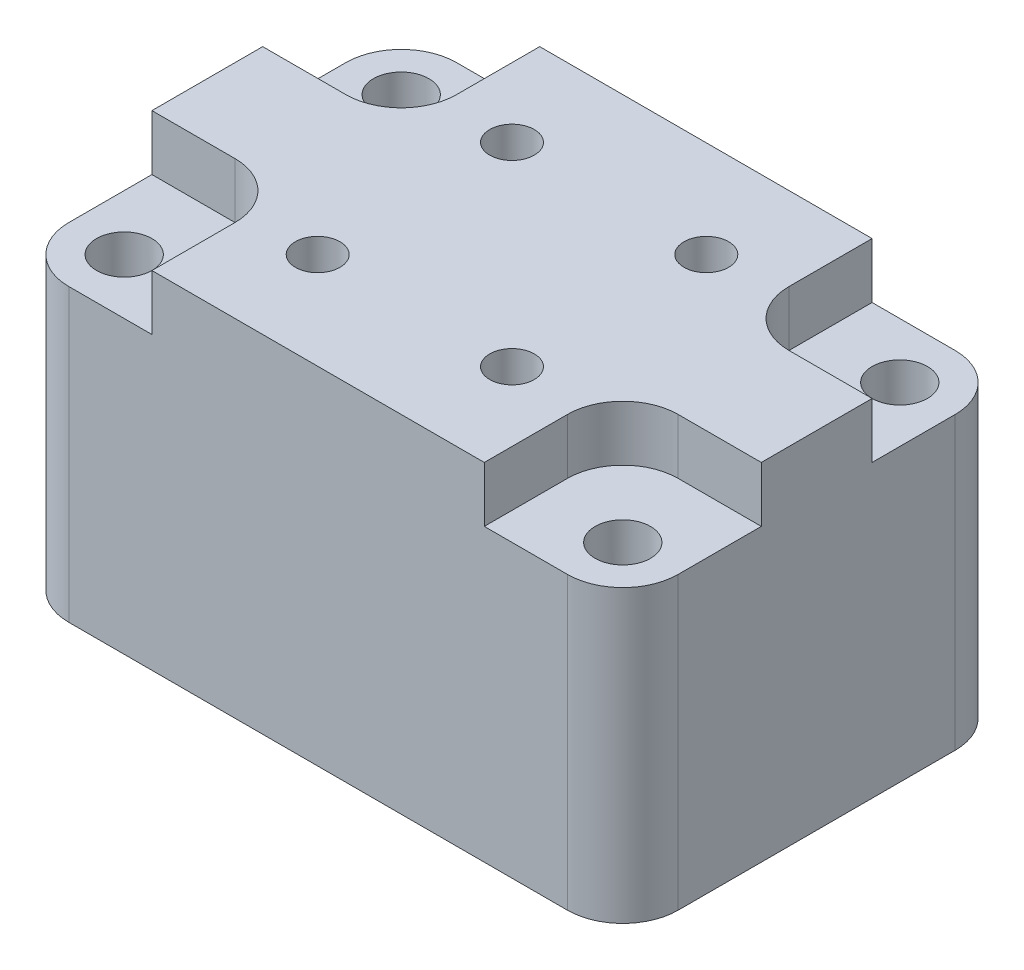
from build123d import *

# Parameters (mm, degrees)
SKETCH1_W                                           = 69.85
SKETCH1_H                                           = 44.45
BOSS_EXTRUDE1_DEPTH                                 = 39.6875
CBORE_FOR_10_BINDING_HEAD_MACHINE_SCREW_D           = 5.1054
CBORE_FOR_10_BINDING_HEAD_MACHINE_SCREW_CBORE_D     = 9.525
CBORE_FOR_10_BINDING_HEAD_MACHINE_SCREW_CBORE_DEPTH = 7.9375
FILLET2_R                                           = 6.35
F_1_4_0_25_DIAMETER_HOLE1_D                         = 6.35
SKETCH9_W                                           = 15.875
SKETCH9_H                                           = 15.875
CUT_EXTRUDE1_DEPTH                                  = 6.35
FILLET3_R                                           = 6.35
FILLET3_OF_MIRROR2_R                                = 6.35
MIRROR3_START                                       = 33.3375
MIRROR3_OUTLINE_R                                   = 3.175
MIRROR3_DEPTH                                       = 6.35


# Read off the part's stored shape, not the designer's step: Mirror3
with BuildPart() as part:
    # Sketch1 → Boss-Extrude1 (new body)
    with BuildSketch(Plane(origin=(0, 0, 0), x_dir=(1, 0, 0), z_dir=(0, 1, 0))):
        Rectangle(SKETCH1_W, SKETCH1_H)
    extrude(amount=BOSS_EXTRUDE1_DEPTH)

    # CBORE for #10 Binding Head Machine Screw1 (through all)
    with Locations(Plane(origin=(0, 0, 0), x_dir=(-1, 0, 0), z_dir=(0, -1, 0))):
        with Locations((-11.136931804, 11.136931804), (11.136931804, 11.136931804), (11.136931804, -11.136931804), (-11.136931804, -11.136931804)):
            CounterBoreHole(CBORE_FOR_10_BINDING_HEAD_MACHINE_SCREW_D / 2, CBORE_FOR_10_BINDING_HEAD_MACHINE_SCREW_CBORE_D / 2, CBORE_FOR_10_BINDING_HEAD_MACHINE_SCREW_CBORE_DEPTH)

    # Fillet2
    fillet2_edges = [part.edges().sort_by_distance(p)[0] for p in [
        (34.925, 19.84375, 22.225),
        (-34.925, 19.84375, 22.225),
        (-34.925, 19.84375, -22.225),
        (34.925, 19.84375, -22.225),
    ]]
    fillet(fillet2_edges, radius=FILLET2_R)

    # 1/4 (0.25) Diameter Hole1 (through all)
    with Locations(Plane(origin=(0, 39.6875, 0), x_dir=(-1, 0, 0), z_dir=(0, 1, 0))):
        with Locations((-28.575, -15.875), (-28.575, 15.875), (28.575, 15.875), (28.575, -15.875)):
            f_1_4_0_25_diameter_hole1 = Hole(F_1_4_0_25_DIAMETER_HOLE1_D / 2)

    # Mirror1: 1/4 (0.25) Diameter Hole1 across plane
    add(f_1_4_0_25_diameter_hole1.mirror(Plane(origin=(0, 0, 0), x_dir=(0, 0, 1), z_dir=(1, 0, 0))), mode=Mode.SUBTRACT)

    # Sketch9 → Cut-Extrude1 (cut)
    with BuildSketch(Plane(origin=(0, 39.6875, 0), x_dir=(1, 0, 0), z_dir=(0, 1, 0))):
        with Locations((-26.9875, 14.2875)):
            Rectangle(SKETCH9_W, SKETCH9_H)
    cut_extrude1 = extrude(amount=-CUT_EXTRUDE1_DEPTH, mode=Mode.SUBTRACT)

    # Fillet3
    fillet3_edges = [part.edges().sort_by_distance(p)[0] for p in [
        (-19.05, 36.5125, -6.35),
    ]]
    fillet(fillet3_edges, radius=FILLET3_R)

    # Mirror2: Cut-Extrude1 across plane
    add(cut_extrude1.mirror(Plane.XY), mode=Mode.SUBTRACT)

    # Fillet3 of Mirror2
    fillet3_of_mirror2_edges = [part.edges().sort_by_distance(p)[0] for p in [
        (-19.05, 36.5125, 6.35),
    ]]
    fillet(fillet3_of_mirror2_edges, radius=FILLET3_OF_MIRROR2_R)

    # Mirror3 outline → Mirror3 (cut)
    # profile 1 of 2: a face of its own
    with BuildSketch(Plane(origin=(0, 0, 0), x_dir=(1, 0, 0), z_dir=(0, 1, 0)).offset(MIRROR3_START)):
        with BuildLine():
            Line((25.4, 6.35), (34.925, 6.35))
            Line((34.925, 6.35), (34.925, 15.875))
            ThreePointArc((34.925, 15.875), (33.065128061, 20.365128061), (28.575, 22.225))
            Line((28.575, 22.225), (19.05, 22.225))
            Line((19.05, 22.225), (19.05, 12.7))
            ThreePointArc((19.05, 12.7), (20.909871939, 8.209871939), (25.4, 6.35))
        make_face()
        with Locations((28.575, 15.875)):
            Circle(MIRROR3_OUTLINE_R, mode=Mode.SUBTRACT)
    # profile 2 of 2: a face of its own
    with BuildSketch(Plane(origin=(0, 0, 0), x_dir=(1, 0, 0), z_dir=(0, 1, 0)).offset(MIRROR3_START)):
        with BuildLine():
            Line((34.925, -15.875), (34.925, -6.35))
            Line((34.925, -6.35), (25.4, -6.35))
            ThreePointArc((25.4, -6.35), (20.909871939, -8.209871939), (19.05, -12.7))
            Line((19.05, -12.7), (19.05, -22.225))
            Line((19.05, -22.225), (28.575, -22.225))
            ThreePointArc((28.575, -22.225), (33.065128061, -20.365128061), (34.925, -15.875))
        make_face()
        with Locations((28.575, -15.875)):
            Circle(MIRROR3_OUTLINE_R, mode=Mode.SUBTRACT)
    extrude(amount=MIRROR3_DEPTH, mode=Mode.SUBTRACT)


solid = part.part
